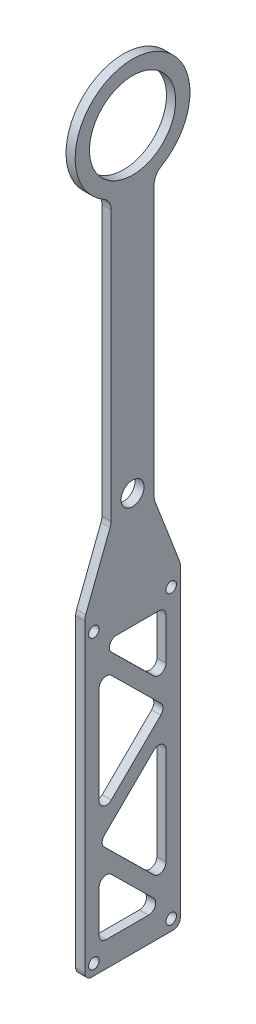
from build123d import *

# Parameters (mm, degrees)
SKETCH1_R           = 1.8288
SKETCH1_R_2         = 4
SKETCH1_R_3         = 15
BOSS_EXTRUDE1_DEPTH = 3.175
CUT_EXTRUDE1_REACH  = 169.323
SKETCH2_W           = 4.112404804
SKETCH2_H           = 133.245584328
FILLET3_R           = 2.5
FILLET4_R           = 5


with BuildPart() as part:
    # Sketch1 → Boss-Extrude1 (new body)
    with BuildSketch(Plane(origin=(0, 0, 0), x_dir=(0, 0, -1), z_dir=(1, 0, 0))):
        with BuildLine():
            Line((20.757404804, -103.81), (20.757404804, -5))
            Line((20.757404804, -5), (7.5, 29.435584328))
            Line((7.5, 29.435584328), (7.5, 127.459503782))
            ThreePointArc((7.5, 127.459503782), (0, 166), (-7.5, 127.459503782))
            Line((-7.5, 127.459503782), (-7.5, 29.435584328))
            Line((-7.5, 29.435584328), (-20.757404804, -5))
            Line((-20.757404804, -5), (-20.757404804, -103.81))
            Line((-20.757404804, -103.81), (20.757404804, -103.81))
        make_face()
        with Locations((-13.4747, -100)):
            Circle(SKETCH1_R, mode=Mode.SUBTRACT)
        with Locations((13.4747, -100)):
            Circle(SKETCH1_R, mode=Mode.SUBTRACT)
        with Locations((13.4747, 0)):
            Circle(SKETCH1_R, mode=Mode.SUBTRACT)
        with Locations((-13.4747, 0)):
            Circle(SKETCH1_R, mode=Mode.SUBTRACT)
        with Locations((0, 35)):
            Circle(SKETCH1_R_2, mode=Mode.SUBTRACT)
        with Locations((0, 146)):
            Circle(SKETCH1_R_3, mode=Mode.SUBTRACT)
    extrude(amount=BOSS_EXTRUDE1_DEPTH)

    # Sketch2 → Cut-Extrude1 (cut, up to next)
    with BuildSketch(Plane(origin=(3.175, 0, 0), x_dir=(0, 0, -1), z_dir=(1, 0, 0)), mode=Mode.PRIVATE) as cut_extrude1_sk1:
        Polygon((11.645, -5), (-11.645, -5), (11.645, -27.976379872), align=None)
    cut_extrude1_tool1 = extrude(cut_extrude1_sk1.sketch, amount=-CUT_EXTRUDE1_REACH, mode=Mode.PRIVATE) & part.part
    # Sketch2 → Cut-Extrude1 (cut, up to next)
    with BuildSketch(Plane(origin=(3.175, 0, 0), x_dir=(0, 0, -1), z_dir=(1, 0, 0)), mode=Mode.PRIVATE) as cut_extrude1_sk2:
        Polygon((-11.645, -12.023620128), (11.645, -35), (-11.645, -57.976379872), (-11.645, -35), align=None)
    cut_extrude1_tool2 = extrude(cut_extrude1_sk2.sketch, amount=-CUT_EXTRUDE1_REACH, mode=Mode.PRIVATE) & part.part
    # Sketch2 → Cut-Extrude1 (cut, up to next)
    with BuildSketch(Plane(origin=(3.175, 0, 0), x_dir=(0, 0, -1), z_dir=(1, 0, 0)), mode=Mode.PRIVATE) as cut_extrude1_sk3:
        Polygon((-11.645, -72.023620128), (-11.645, -95), (11.645, -95), align=None)
    cut_extrude1_tool3 = extrude(cut_extrude1_sk3.sketch, amount=-CUT_EXTRUDE1_REACH, mode=Mode.PRIVATE) & part.part
    # Sketch2 → Cut-Extrude1 (cut, up to next)
    with BuildSketch(Plane(origin=(3.175, 0, 0), x_dir=(0, 0, -1), z_dir=(1, 0, 0)), mode=Mode.PRIVATE) as cut_extrude1_sk4:
        Polygon((11.645, -42.023620128), (11.645, -65), (11.645, -87.976379872), (-11.645, -65), align=None)
    cut_extrude1_tool4 = extrude(cut_extrude1_sk4.sketch, amount=-CUT_EXTRUDE1_REACH, mode=Mode.PRIVATE) & part.part
    # Sketch2 → Cut-Extrude1 (cut, up to next)
    with BuildSketch(Plane(origin=(3.175, 0, 0), x_dir=(0, 0, -1), z_dir=(1, 0, 0)), mode=Mode.PRIVATE) as cut_extrude1_sk5:
        with Locations((-18.701202402, -37.187207836)):
            Rectangle(SKETCH2_W, SKETCH2_H)
    cut_extrude1_tool5 = extrude(cut_extrude1_sk5.sketch, amount=-CUT_EXTRUDE1_REACH, mode=Mode.PRIVATE) & part.part
    # Sketch2 → Cut-Extrude1 (cut, up to next)
    with BuildSketch(Plane(origin=(3.175, 0, 0), x_dir=(0, 0, -1), z_dir=(1, 0, 0)), mode=Mode.PRIVATE) as cut_extrude1_sk6:
        with Locations((18.701202402, -37.187207836)):
            Rectangle(SKETCH2_W, SKETCH2_H)
    cut_extrude1_tool6 = extrude(cut_extrude1_sk6.sketch, amount=-CUT_EXTRUDE1_REACH, mode=Mode.PRIVATE) & part.part
    add(cut_extrude1_tool1.solids().sort_by_distance((3.175, -12.658793, -3.881667))[0], mode=Mode.SUBTRACT)
    add(cut_extrude1_tool2.solids().sort_by_distance((3.175, -35, 3.881667))[0], mode=Mode.SUBTRACT)
    add(cut_extrude1_tool3.solids().sort_by_distance((3.175, -87.341207, 3.881667))[0], mode=Mode.SUBTRACT)
    add(cut_extrude1_tool4.solids().sort_by_distance((3.175, -65, -3.881667))[0], mode=Mode.SUBTRACT)
    add(cut_extrude1_tool5.solids().sort_by_distance((3.175, -37.187208, 18.701202))[0], mode=Mode.SUBTRACT)
    add(cut_extrude1_tool6.solids().sort_by_distance((3.175, -37.187208, -18.701202))[0], mode=Mode.SUBTRACT)

    # Fillet3
    fillet3_edges = [part.edges().sort_by_distance(p)[0] for p in [
        (1.5875, -57.976379872, 11.645),
        (1.5875, -35, -11.645),
        (1.5875, -95, -11.645),
        (1.5875, -72.023620128, 11.645),
        (1.5875, -95, 11.645),
        (1.5875, -27.976379872, -11.645),
        (1.5875, -5, -11.645),
        (1.5875, -12.023620128, 11.645),
        (1.5875, -5, 11.645),
        (1.5875, -87.976379872, -11.645),
        (1.5875, -42.023620128, -11.645),
        (1.5875, -65, 11.645),
        (1.5875, -103.81, -16.645),
        (1.5875, -103.81, 16.645),
    ]]
    fillet(fillet3_edges, radius=FILLET3_R)

    # Fillet4
    fillet4_edges = [part.edges().sort_by_distance(p)[0] for p in [
        (1.5875, 29.435584328, -7.5),
        (1.5875, 29.435584328, 7.5),
        (1.5875, 5.681808734, 16.645),
        (1.5875, 5.681808734, -16.645),
        (1.5875, 127.459503782, -7.5),
        (1.5875, 127.459503782, 7.5),
    ]]
    fillet(fillet4_edges, radius=FILLET4_R)


solid = part.part
